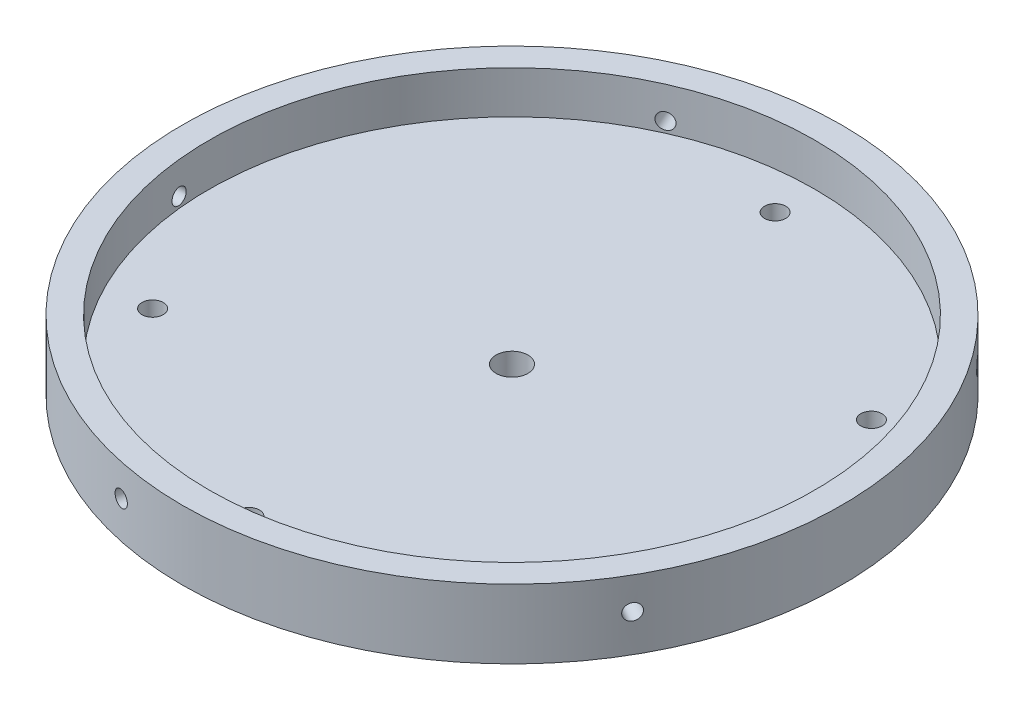
from build123d import *

# Parameters (mm, degrees)
SKETCH1_R               = 62
BOSS_EXTRUDE1_DEPTH     = 5
SKETCH2_R               = 2
CUT_EXTRUDE1_DEPTH      = 5
CIRPATTERN1_COUNT       = 2
CIRPATTERN1_ANGLE       = 120
MIRROR1_COPY_1_SKETCH_R = 2
MIRROR1_COPY_1_DEPTH    = 5
SKETCH5_R               = 62
SKETCH5_R_2             = 57
BOSS_EXTRUDE2_DEPTH     = 8
CUT_EXTRUDE2_START      = -90
SKETCH6_R               = 1.5
CUT_EXTRUDE2_DEPTH      = 91
CIRPATTERN2_COUNT       = 5
SKETCH7_R               = 3
CUT_EXTRUDE3_DEPTH      = 10


with BuildPart() as part:
    # Sketch1 → Boss-Extrude1 (new body)
    with BuildSketch(Plane(origin=(0, 0, 0), x_dir=(1, 0, 0), z_dir=(0, 1, 0))):
        Circle(SKETCH1_R)
    extrude(amount=BOSS_EXTRUDE1_DEPTH)

    # Sketch2 → Cut-Extrude1 (cut)
    with BuildSketch(Plane(origin=(0, 5, 0), x_dir=(1, 0, 0), z_dir=(0, 1, 0))):
        with Locations((0, 49.5)):
            Circle(SKETCH2_R)
    cut_extrude1 = extrude(amount=-CUT_EXTRUDE1_DEPTH, mode=Mode.SUBTRACT)

    # CirPattern1: Cut-Extrude1 ×2 about axis
    cirpattern1_axis = Axis((0, 5, 0), (0, 1, 0))
    for i in range(1, CIRPATTERN1_COUNT):
        add(cut_extrude1.rotate(cirpattern1_axis, i * CIRPATTERN1_ANGLE / (CIRPATTERN1_COUNT - 1)), mode=Mode.SUBTRACT)

    # Mirror1: Cut-Extrude1 across plane
    add(cut_extrude1.mirror(Plane(origin=(0, 0, 0), x_dir=(-0.49999999999999806, 0, 0.8660254037844398), z_dir=(-0.8660254037844398, 0, -0.49999999999999806))), mode=Mode.SUBTRACT)

    # Mirror1 copy 1 sketch → Mirror1 copy 1 (cut)
    with BuildSketch(Plane(origin=(0, 5, 0), x_dir=(1, 0, 0), z_dir=(0, 1, 0))):
        with Locations((0, -49.5)):
            Circle(MIRROR1_COPY_1_SKETCH_R)
    extrude(amount=-MIRROR1_COPY_1_DEPTH, mode=Mode.SUBTRACT)

    # Sketch5 → Boss-Extrude2 (add)
    with BuildSketch(Plane(origin=(0, 5, 0), x_dir=(1, 0, 0), z_dir=(0, 1, 0))):
        Circle(SKETCH5_R)
        Circle(SKETCH5_R_2, mode=Mode.SUBTRACT)
    extrude(amount=BOSS_EXTRUDE2_DEPTH)

    # Sketch6 → Cut-Extrude2 (cut)
    with BuildSketch(Plane(origin=(0, 0, 0), x_dir=(-0.49999999999999806, 0, 0.8660254037844398), z_dir=(-0.8660254037844398, 0, -0.49999999999999806)).offset(CUT_EXTRUDE2_START)):
        with Locations((0, 7)):
            Circle(SKETCH6_R)
    cut_extrude2 = extrude(amount=CUT_EXTRUDE2_DEPTH, mode=Mode.SUBTRACT)

    # CirPattern2: Cut-Extrude2 ×5 about axis
    cirpattern2_axis = Axis((0, 13, 0), (0, 1, 0))
    for i in range(1, CIRPATTERN2_COUNT):
        add(cut_extrude2.rotate(cirpattern2_axis, i * 360 / CIRPATTERN2_COUNT), mode=Mode.SUBTRACT)

    # Sketch7 → Cut-Extrude3 (cut)
    with BuildSketch(Plane(origin=(0, 5, 0), x_dir=(1, 0, 0), z_dir=(0, 1, 0))):
        Circle(SKETCH7_R)
    extrude(amount=-CUT_EXTRUDE3_DEPTH, mode=Mode.SUBTRACT)


solid = part.part
